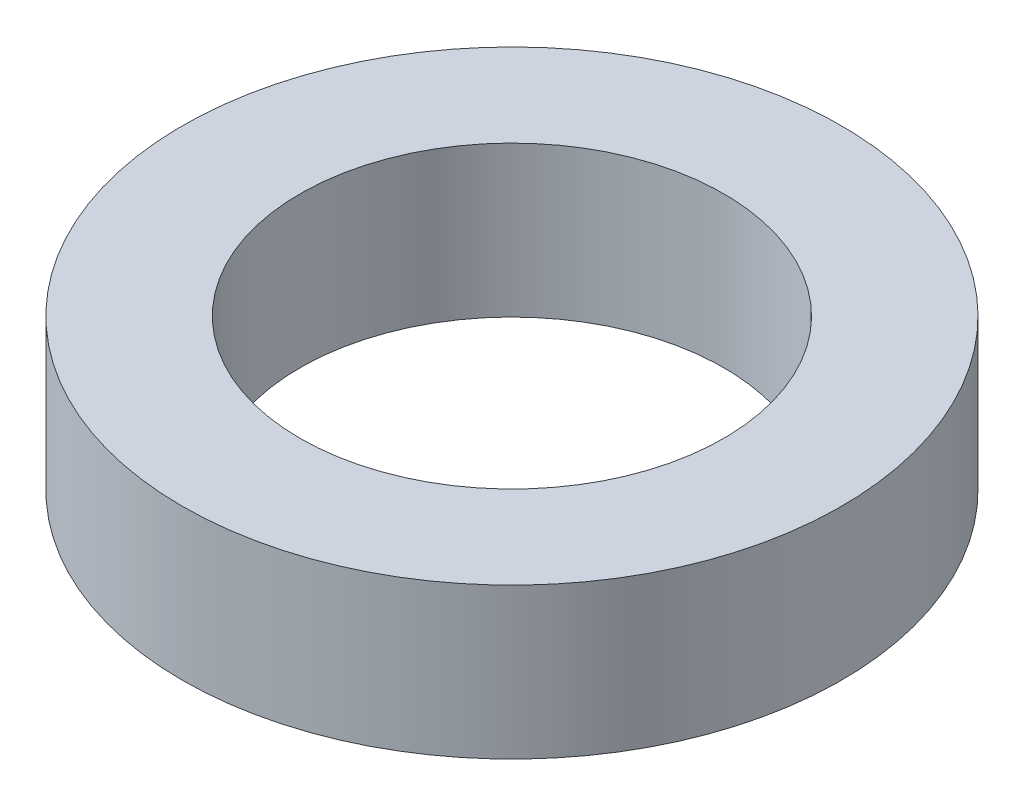
from build123d import *

# Parameters (mm, degrees)
SKETCH1_R           = 35
BOSS_EXTRUDE1_DEPTH = 16
SKETCH2_R           = 22.5
CUT_EXTRUDE1_DEPTH  = 53.019227215


with BuildPart() as part:
    # Sketch1 → Boss-Extrude1 (new body)
    with BuildSketch(Plane(origin=(0, 0, 0), x_dir=(1, 0, 0), z_dir=(0, 1, 0))):
        Circle(SKETCH1_R)
    extrude(amount=BOSS_EXTRUDE1_DEPTH)

    # Sketch2 → Cut-Extrude1 (cut, through all)
    with BuildSketch(Plane(origin=(0, 0, 0), x_dir=(1, 0, 0), z_dir=(0, 1, 0))):
        Circle(SKETCH2_R)
    extrude(amount=CUT_EXTRUDE1_DEPTH, mode=Mode.SUBTRACT)


solid = part.part
